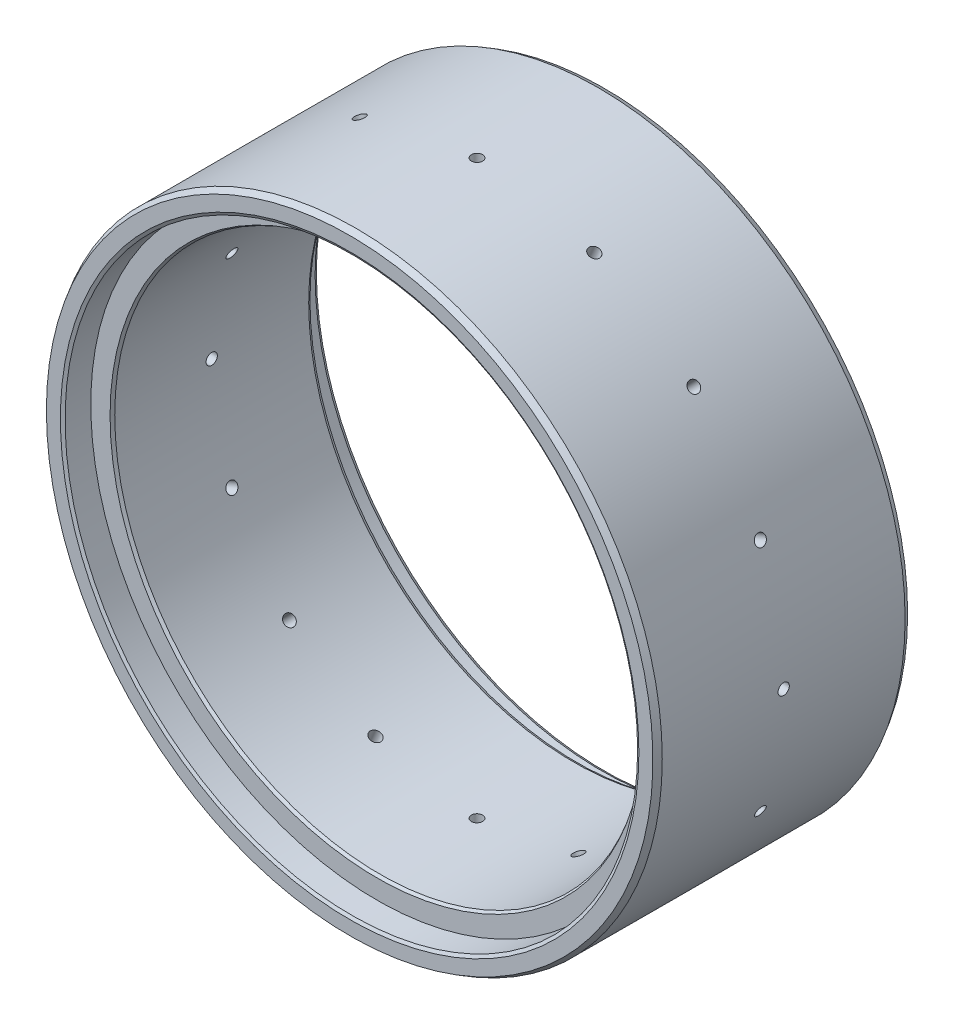
from build123d import *
from OCP.BRepFilletAPI import BRepFilletAPI_MakeChamfer

# Parameters (mm, degrees)
SKETCH1_R         = 68.199
SKETCH1_R_2       = 58.9915
EXTRUDE1_DEPTH    = 28.321
SKETCH11_R        = 63.66002
EXTRUDE2_DEPTH    = 6.096
CIRPATTERN1_COUNT = 16
CHAMFER1_SIZE     = 0.381
CHAMFER1_SIZE2    = 0.659911358
CHAMFER3_SIZE     = 0.762
CHAMFER3_SIZE2    = 1.319822715


with BuildPart() as part:
    # Sketch1 → Extrude1 (new, symmetric)
    with BuildSketch(Plane.XY):
        Circle(SKETCH1_R)
        Circle(SKETCH1_R_2, mode=Mode.SUBTRACT)
    extrude(amount=EXTRUDE1_DEPTH, both=True)

    # Sketch11 → Extrude2 (cut)
    with BuildSketch(Plane(origin=(0, 0, -28.321), x_dir=(-1, 0, 0), z_dir=(0, 0, -1))):
        Circle(SKETCH11_R)
    extrude2 = extrude(amount=-EXTRUDE2_DEPTH, mode=Mode.SUBTRACT)

    # Mirror1: Extrude2 across plane
    add(extrude2.mirror(Plane.XY), mode=Mode.SUBTRACT)

    # Sketch4 → Tap Drill for M3x0.5 Tap1 (revolve, cut)
    with BuildSketch(Plane(origin=(0, 68.199, 0), x_dir=(0, 0, 1), z_dir=(1, 0, 0))):
        Polygon((0, 0), (0, 10.911075774), (1.25, 10.16), (1.25, 0), align=None)
    tap_drill_for_m3x0_5_tap1 = revolve(axis=Axis((0, 74.549, 0), (0, -1, 0)), mode=Mode.SUBTRACT)

    # CirPattern1: Tap Drill for M3x0.5 Tap1 ×16 about axis
    cirpattern1_axis = Axis((0, 0, 28.321), (0, 0, -1))
    for i in range(1, CIRPATTERN1_COUNT):
        add(tap_drill_for_m3x0_5_tap1.rotate(cirpattern1_axis, i * 360 / CIRPATTERN1_COUNT), mode=Mode.SUBTRACT)

    # Chamfer1: one chamfer whose edges measure the first distance from different faces: ONE call of the kernel's chamfer builder (chamfer() names one face for all edges)
    chamfer1_edges_1 = [part.edges().sort_by_distance(p)[0] for p in [
        (-58.9915, 0, -22.225),
    ]]
    chamfer1_side_1 = [part.faces().sort_by_distance(p)[0] for p in [
        (61.859442727, 0, -22.225),
    ]]
    chamfer1_edges_2 = [part.edges().sort_by_distance(p)[0] for p in [
        (63.66002, 0, 28.321),
    ]]
    chamfer1_side_2 = [part.faces().sort_by_distance(p)[0] for p in [
        (63.66002, 0, 25.273),
    ]]
    chamfer1_edges_3 = [part.edges().sort_by_distance(p)[0] for p in [
        (-58.9915, 0, 22.225),
    ]]
    chamfer1_side_3 = [part.faces().sort_by_distance(p)[0] for p in [
        (61.859442727, 0, 22.225),
    ]]
    chamfer1_edges_4 = [part.edges().sort_by_distance(p)[0] for p in [
        (63.66002, 0, -28.321),
    ]]
    chamfer1_side_4 = [part.faces().sort_by_distance(p)[0] for p in [
        (-66.270040985, 0, -28.321),
    ]]
    chamfer1 = BRepFilletAPI_MakeChamfer(part.part.solid().wrapped)
    for e in chamfer1_edges_1:
        chamfer1.Add(CHAMFER1_SIZE, CHAMFER1_SIZE2, e.wrapped, chamfer1_side_1[0].wrapped)  # the first distance lies on this face
    for e in chamfer1_edges_2:
        chamfer1.Add(CHAMFER1_SIZE, CHAMFER1_SIZE2, e.wrapped, chamfer1_side_2[0].wrapped)  # the first distance lies on this face
    for e in chamfer1_edges_3:
        chamfer1.Add(CHAMFER1_SIZE, CHAMFER1_SIZE2, e.wrapped, chamfer1_side_3[0].wrapped)  # the first distance lies on this face
    for e in chamfer1_edges_4:
        chamfer1.Add(CHAMFER1_SIZE, CHAMFER1_SIZE2, e.wrapped, chamfer1_side_4[0].wrapped)  # the first distance lies on this face
    add(Compound.cast(chamfer1.Shape()), mode=Mode.REPLACE)

    # Chamfer3: one chamfer whose edges measure the first distance from different faces: ONE call of the kernel's chamfer builder (chamfer() names one face for all edges)
    chamfer3_edges_1 = [part.edges().sort_by_distance(p)[0] for p in [
        (-68.199, 0, 28.321),
    ]]
    chamfer3_side_1 = [part.faces().sort_by_distance(p)[0] for p in [
        (66.248890372, 0, 28.321),
    ]]
    chamfer3_edges_2 = [part.edges().sort_by_distance(p)[0] for p in [
        (-68.199, 0, -28.321),
    ]]
    chamfer3_side_2 = [part.faces().sort_by_distance(p)[0] for p in [
        (65.969979015, 0, -28.321),
    ]]
    chamfer3 = BRepFilletAPI_MakeChamfer(part.part.solid().wrapped)
    for e in chamfer3_edges_1:
        chamfer3.Add(CHAMFER3_SIZE, CHAMFER3_SIZE2, e.wrapped, chamfer3_side_1[0].wrapped)  # the first distance lies on this face
    for e in chamfer3_edges_2:
        chamfer3.Add(CHAMFER3_SIZE, CHAMFER3_SIZE2, e.wrapped, chamfer3_side_2[0].wrapped)  # the first distance lies on this face
    add(Compound.cast(chamfer3.Shape()), mode=Mode.REPLACE)


solid = part.part
